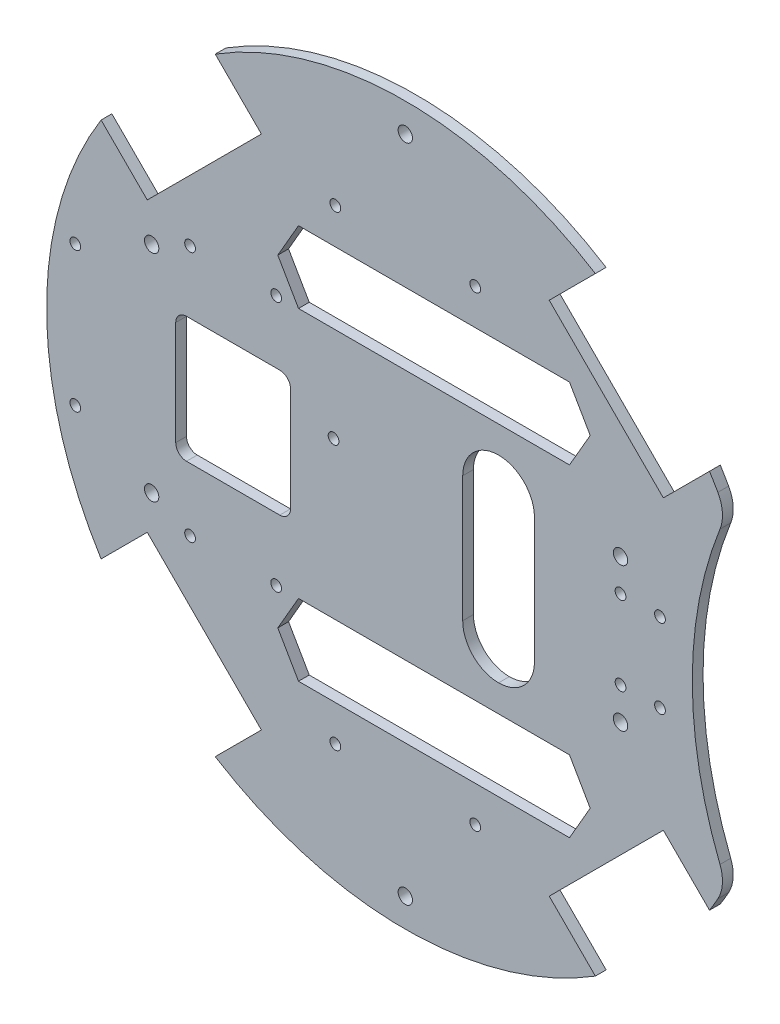
from build123d import *

# Parameters (mm, degrees)
CROQUIS1_R              = 100
SALIENTE_EXTRUIR1_DEPTH = 3
CROQUIS3_R              = 110
CORTAR_EXTRUIR1_DEPTH   = 3
REDONDEO1_R             = 10
CORTAR_EXTRUIR3_DEPTH   = 10
CROQUIS10_R             = 1.5
CORTAR_EXTRUIR4_DEPTH   = 142.453172607
CROQUIS12_R             = 1.5
CORTAR_EXTRUIR6_DEPTH   = 142.453172607
CROQUIS13_R             = 2
CORTAR_EXTRUIR7_DEPTH   = 142.453172607
CROQUIS15_W             = 32
CROQUIS15_H             = 35
CORTAR_EXTRUIR8_DEPTH   = 142.453172607
REDONDEO2_R             = 3
CROQUIS16_R             = 1.5
CORTAR_EXTRUIR9_DEPTH   = 142.453172607
CROQUIS17_W             = 20
CROQUIS17_H             = 55
CORTAR_EXTRUIR10_DEPTH  = 142.453172607
REDONDEO3_R             = 10


with BuildPart() as part:
    # Croquis1 → Saliente-Extruir1 (new body)
    with BuildSketch(Plane.XY):
        Circle(CROQUIS1_R)
    extrude(amount=SALIENTE_EXTRUIR1_DEPTH)

    # Croquis3 → Cortar-Extruir1 (cut)
    with BuildSketch(Plane.XY.offset(3)):
        with Locations((190, 0)):
            Circle(CROQUIS3_R)
    extrude(amount=-CORTAR_EXTRUIR1_DEPTH, mode=Mode.SUBTRACT)

    # Redondeo1
    redondeo1_edges = [part.edges().sort_by_distance(p)[0] for p in [
        (89.473684211, -44.659375654, 1.5),
        (89.473684211, 44.659375654, 1.5),
    ]]
    fillet(redondeo1_edges, radius=REDONDEO1_R)

    # Croquis7 → Cortar-Extruir3 (cut)
    with BuildSketch(Plane.XY.offset(3)):
        Polygon((-71.939339828, -40.119534675), (-40.119534675, -71.939339828), (-57.797204204, -89.617009358), (-89.617009358, -57.797204204), align=None)
        Polygon((-40.119534675, 71.939339828), (-71.939339828, 40.119534675), (-89.617009358, 57.797204204), (-57.797204204, 89.617009358), align=None)
        Polygon((71.939339828, 40.119534675), (40.119534675, 71.939339828), (57.797204204, 89.617009358), (89.617009358, 57.797204204), align=None)
        Polygon((40.119534675, -71.939339828), (71.939339828, -40.119534675), (89.617009358, -57.797204204), (57.797204204, -89.617009358), align=None)
    extrude(amount=-CORTAR_EXTRUIR3_DEPTH, mode=Mode.SUBTRACT)

    # Croquis10 → Cortar-Extruir4 (cut, through all)
    with BuildSketch(Plane.XY.offset(3)):
        with Locations((-20, 8.5)):
            Circle(CROQUIS10_R)
    extrude(amount=-CORTAR_EXTRUIR4_DEPTH, mode=Mode.SUBTRACT)

    # Croquis12 → Cortar-Extruir6 (cut, through all)
    with BuildSketch(Plane(origin=(0, 0, 0), x_dir=(-1, 0, 0), z_dir=(0, 0, -1))):
        with Locations((-71, 11)):
            Circle(CROQUIS12_R)
        with Locations((-71, -11)):
            Circle(CROQUIS12_R)
        with Locations((-60, 11)):
            Circle(CROQUIS12_R)
        with Locations((-60, -11)):
            Circle(CROQUIS12_R)
    extrude(amount=-CORTAR_EXTRUIR6_DEPTH, mode=Mode.SUBTRACT)

    # Croquis13 → Cortar-Extruir7 (cut, through all)
    with BuildSketch(Plane(origin=(0, 0, 0), x_dir=(-1, 0, 0), z_dir=(0, 0, -1))):
        with Locations((0, 92)):
            Circle(CROQUIS13_R)
        with Locations((0, -92)):
            Circle(CROQUIS13_R)
        with Locations((70.711068531, 30)):
            Circle(CROQUIS13_R)
        with Locations((70.711643931, -30)):
            Circle(CROQUIS13_R)
        with Locations((-60, 20)):
            Circle(CROQUIS13_R)
        with Locations((-60, -20)):
            Circle(CROQUIS13_R)
    extrude(amount=-CORTAR_EXTRUIR7_DEPTH, mode=Mode.SUBTRACT)

    # Croquis15 → Cortar-Extruir8 (cut, through all)
    with BuildSketch(Plane(origin=(0, 0, 0), x_dir=(-1, 0, 0), z_dir=(0, 0, -1))):
        Polygon((18.226497308, 55), (-34.226497308, 55), (-28.452994616, 45), (-34.226497308, 35), (18.226497308, 35), (12.452994616, 45), align=None)
        Polygon((-34.226497308, 55), (-40, 55), (-40, 35), (-34.226497308, 35), (-28.452994616, 45), align=None)
        Polygon((-40, 35), (-40, 55), (-45.773502692, 55), (-51.547005384, 45), (-45.773502692, 35), align=None)
        Polygon((29.773502692, 55), (24, 55), (24, 35), (29.773502692, 35), (35.547005384, 45), align=None)
        Polygon((24, 55), (18.226497308, 55), (12.452994616, 45), (18.226497308, 35), (24, 35), align=None)
        Polygon((12.452994616, -45), (18.226497308, -35), (-34.226497308, -35), (-28.452994616, -45), (-34.226497308, -55), (18.226497308, -55), align=None)
        Polygon((24, -55), (24, -35), (18.226497308, -35), (12.452994616, -45), (18.226497308, -55), align=None)
        Polygon((35.547005384, -45), (29.773502692, -35), (24, -35), (24, -55), (29.773502692, -55), align=None)
        Polygon((-28.452994616, -45), (-34.226497308, -35), (-40, -35), (-40, -55), (-34.226497308, -55), align=None)
        Polygon((-40, -55), (-40, -35), (-45.773502692, -35), (-51.547005384, -45), (-45.773502692, -55), align=None)
        with Locations((48, 0)):
            Rectangle(CROQUIS15_W, CROQUIS15_H)
    extrude(amount=-CORTAR_EXTRUIR8_DEPTH, mode=Mode.SUBTRACT)

    # Redondeo2
    redondeo2_edges = [part.edges().sort_by_distance(p)[0] for p in [
        (-64, 17.5, 1.5),
        (-32, 17.5, 1.5),
        (-32, -17.5, 1.5),
        (-64, -17.5, 1.5),
    ]]
    fillet(redondeo2_edges, radius=REDONDEO2_R)

    # Croquis16 → Cortar-Extruir9 (cut, through all)
    with BuildSketch(Plane(origin=(0, 0, 0), x_dir=(-1, 0, 0), z_dir=(0, 0, -1))):
        with Locations((-19.5, 65)):
            Circle(CROQUIS16_R)
        with Locations((19.5, 65)):
            Circle(CROQUIS16_R)
        with Locations(Location((19.5, -65, 0), (0, 0, 180))):
            Circle(CROQUIS16_R)
        with Locations(Location((-19.5, -65, 0), (0, 0, 180))):
            Circle(CROQUIS16_R)
        with Locations((36, 35)):
            Circle(CROQUIS16_R)
        with Locations((36, -35)):
            Circle(CROQUIS16_R)
        with Locations((60, -35)):
            Circle(CROQUIS16_R)
        with Locations((60, 35)):
            Circle(CROQUIS16_R)
        with Locations((92, 19.5)):
            Circle(CROQUIS16_R)
        with Locations((92, -19.5)):
            Circle(CROQUIS16_R)
    extrude(amount=-CORTAR_EXTRUIR9_DEPTH, mode=Mode.SUBTRACT)

    # Croquis17 → Cortar-Extruir10 (cut, through all)
    with BuildSketch(Plane(origin=(0, 0, 0), x_dir=(-1, 0, 0), z_dir=(0, 0, -1))):
        with Locations((-26, 0)):
            Rectangle(CROQUIS17_W, CROQUIS17_H)
    extrude(amount=-CORTAR_EXTRUIR10_DEPTH, mode=Mode.SUBTRACT)

    # Redondeo3
    redondeo3_edges = [part.edges().sort_by_distance(p)[0] for p in [
        (16, -27.5, 1.5),
        (36, -27.5, 1.5),
        (16, 27.5, 1.5),
        (36, 27.5, 1.5),
    ]]
    fillet(redondeo3_edges, radius=REDONDEO3_R - 0.0001)  # a hair under: the kernel refuses the full size


solid = part.part
